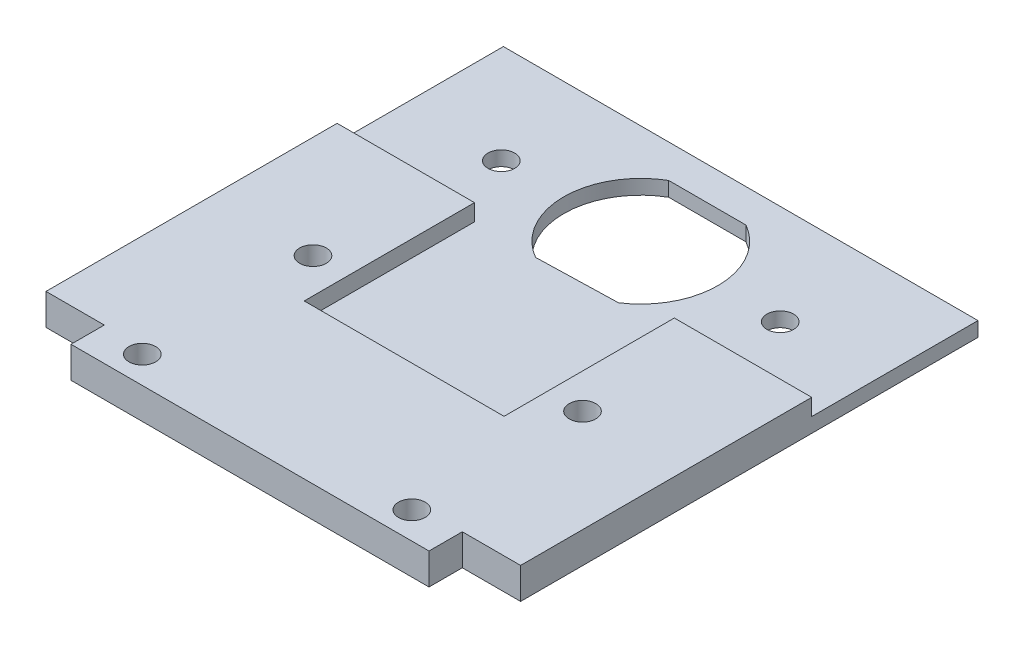
from build123d import *

# Parameters (mm, degrees)
AUFSATZ_LINEAR_AUSTRAGEN1_DEPTH = 3.75
SKIZZE16_W                      = 57
SKIZZE16_H                      = 19.970174162
SCHNITT_LINEAR_AUSTRAGEN6_DEPTH = 2
SCHNITT_LINEAR_AUSTRAGEN1_DEPTH = 2
SKIZZE10_R                      = 1.6
SCHNITT_LINEAR_AUSTRAGEN3_DEPTH = 3.2
SKIZZE17_R                      = 1.6
SCHNITT_LINEAR_AUSTRAGEN7_DEPTH = 4
SKIZZE18_W                      = 24
SKIZZE18_H                      = 20.451513558
SCHNITT_LINEAR_AUSTRAGEN8_DEPTH = 2


with BuildPart() as part:
    # Skizze1 → Aufsatz-Linear austragen1 (new body)
    with BuildSketch(Plane(origin=(0, 0, 0), x_dir=(1, 0, 0), z_dir=(0, 1, 0))):
        Polygon((0, 4), (7, 4), (7, 0), (17.778730529, 0), (38.778730529, 0), (50, 0), (50, 4), (57, 4), (57, 58.933855223), (0, 58.933855223), align=None)
    extrude(amount=-AUFSATZ_LINEAR_AUSTRAGEN1_DEPTH)

    # Skizze16 → Schnitt-Linear austragen6 (cut)
    with BuildSketch(Plane(origin=(0, 0, 0), x_dir=(1, 0, 0), z_dir=(0, 1, 0))):
        with Locations((28.5, 48.948768142)):
            Rectangle(SKIZZE16_W, SKIZZE16_H)
    extrude(amount=-SCHNITT_LINEAR_AUSTRAGEN6_DEPTH, mode=Mode.SUBTRACT)

    # Skizze3 → Schnitt-Linear austragen1 (cut)
    with BuildSketch(Plane(origin=(0, -2, 0), x_dir=(1, 0, 0), z_dir=(0, 1, 0))):
        with BuildLine():
            Line((33.565408487, 39.194078943), (23.856456095, 38.933855223))
            ThreePointArc((23.856456095, 38.933855223), (19.25, 46.933855223), (23.856456095, 54.933855223))
            Line((23.856456095, 54.933855223), (33.143543905, 54.933855223))
            ThreePointArc((33.143543905, 54.933855223), (37.746679321, 47.181688892), (33.565408487, 39.194078943))
        make_face()
    extrude(amount=-SCHNITT_LINEAR_AUSTRAGEN1_DEPTH, mode=Mode.SUBTRACT)

    # Skizze10 → Schnitt-Linear austragen3 (cut)
    with BuildSketch(Plane(origin=(0, -2, 0), x_dir=(1, 0, 0), z_dir=(0, 1, 0))):
        with Locations((45.25, 46.933855223)):
            Circle(SKIZZE10_R)
        with Locations((11.75, 46.933855223)):
            Circle(SKIZZE10_R)
    extrude(amount=-SCHNITT_LINEAR_AUSTRAGEN3_DEPTH, mode=Mode.SUBTRACT)

    # Skizze17 → Schnitt-Linear austragen7 (cut)
    with BuildSketch(Plane(origin=(0, 0, 0), x_dir=(1, 0, 0), z_dir=(0, 1, 0))):
        with Locations((44.684736485, 3.25)):
            Circle(SKIZZE17_R)
        with Locations((44.684736485, 23.75)):
            Circle(SKIZZE17_R)
        with Locations((12.315263515, 3.25)):
            Circle(SKIZZE17_R)
        with Locations((12.315263515, 23.75)):
            Circle(SKIZZE17_R)
    extrude(amount=-SCHNITT_LINEAR_AUSTRAGEN7_DEPTH, mode=Mode.SUBTRACT)

    # Skizze18 → Schnitt-Linear austragen8 (cut)
    with BuildSketch(Plane(origin=(0, 0, 0), x_dir=(1, 0, 0), z_dir=(0, 1, 0))):
        with Locations((28.5, 28.737924282)):
            Rectangle(SKIZZE18_W, SKIZZE18_H)
    extrude(amount=-SCHNITT_LINEAR_AUSTRAGEN8_DEPTH, mode=Mode.SUBTRACT)


solid = part.part
